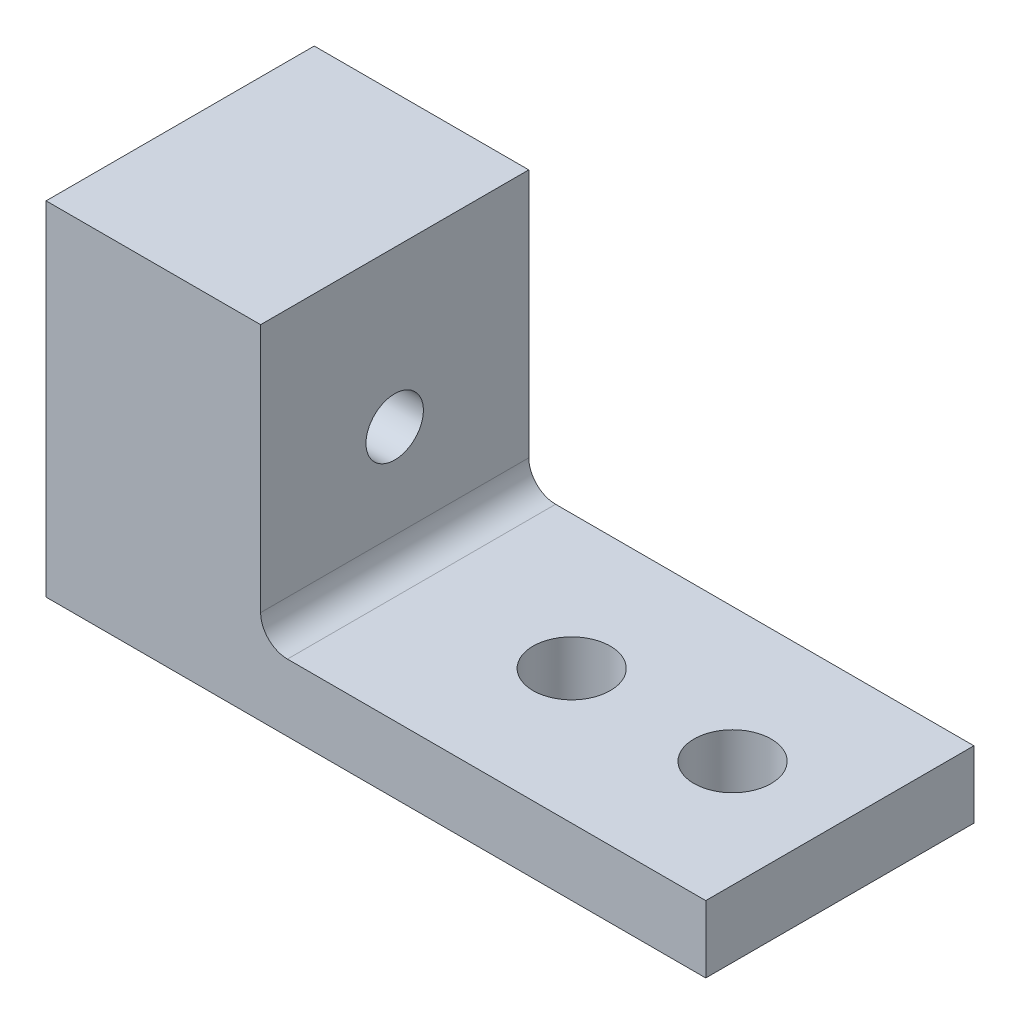
from build123d import *

# Parameters (mm, degrees)
BOSS_EXTRUDE1_DEPTH = 6.35
CUT_EXTRUDE1_REACH  = 37.786
SKETCH2_R           = 1.3589
CUT_EXTRUDE2_REACH  = 37.786
SKETCH3_R           = 1.8288
FILLET2_R           = 1.27
LPATTERN1_COUNT     = 2
LPATTERN1_PITCH     = 7.62


with BuildPart() as part:
    # Sketch1 → Boss-Extrude1 (new, symmetric)
    with BuildSketch(Plane.XY):
        Polygon((0, 0), (0, 16.256), (10.16, 16.256), (10.16, 3.175), (31.242, 3.175), (31.242, 0), align=None)
    extrude(amount=BOSS_EXTRUDE1_DEPTH, both=True)

    # Sketch2 → Cut-Extrude1 (cut, up to next)
    with BuildSketch(Plane.ZY, mode=Mode.PRIVATE) as cut_extrude1_sk1:
        with Locations((0, 8.89)):
            Circle(SKETCH2_R)
    cut_extrude1_tool1 = extrude(cut_extrude1_sk1.sketch, amount=-CUT_EXTRUDE1_REACH, mode=Mode.PRIVATE) & part.part
    add(cut_extrude1_tool1.solids().sort_by_distance((0, 8.89, 0))[0], mode=Mode.SUBTRACT)

    # Sketch3 → Cut-Extrude2 (cut, up to next)
    with BuildSketch(Plane.XZ, mode=Mode.PRIVATE) as cut_extrude2_sk1:
        with Locations((18.542, 0)):
            Circle(SKETCH3_R)
    cut_extrude2_tool1 = extrude(cut_extrude2_sk1.sketch, amount=-CUT_EXTRUDE2_REACH, mode=Mode.PRIVATE) & part.part
    cut_extrude2 = cut_extrude2_tool1.solids().sort_by_distance((18.542, 0, 0))[0]
    add(cut_extrude2, mode=Mode.SUBTRACT)

    # Fillet2
    fillet2_edges = [part.edges().sort_by_distance(p)[0] for p in [
        (10.16, 3.175, 0),
    ]]
    fillet(fillet2_edges, radius=FILLET2_R)

    # LPattern1: Cut-Extrude2 ×2
    with Locations(*[(i * LPATTERN1_PITCH, 0, 0) for i in range(1, LPATTERN1_COUNT)]):
        add(cut_extrude2, mode=Mode.SUBTRACT)


solid = part.part
